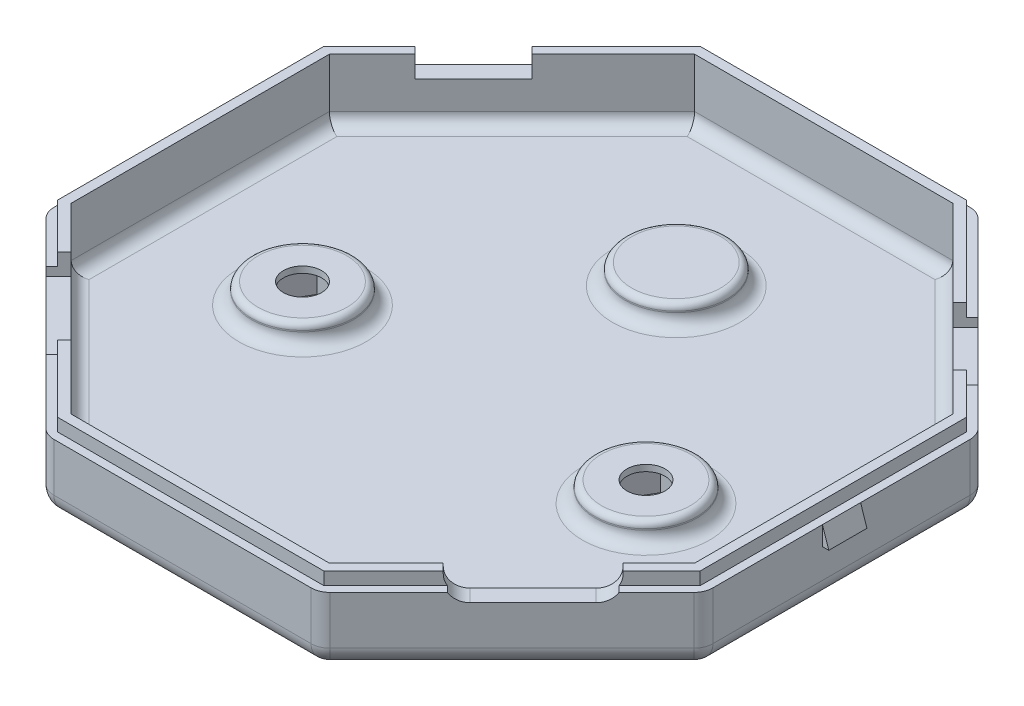
from build123d import *

# Parameters (mm, degrees)
BOSS_EXTRUDE1_DEPTH = 4.9
BOSS_EXTRUDE2_DEPTH = 1.4
SKETCH1_5_R         = 4
SKETCH1_5_R_2       = 1.5
BOSS_EXTRUDE3_DEPTH = 1.6
FILLET1_R           = 1
FILLET2_R           = 0.5
CUT_EXTRUDE1_DEPTH  = 1.7
FILLET3_R           = 1.5
CUT_EXTRUDE2_DEPTH  = 1
CUT_EXTRUDE4_DEPTH  = 10
CUT_EXTRUDE5_DEPTH  = 1.1
BOSS_EXTRUDE5_DEPTH = 1.5


with BuildPart() as part:
    # Sketch1 → Boss-Extrude1 (new body)
    with BuildSketch(Plane(origin=(0, 0, 0), x_dir=(1, 0, 0), z_dir=(0, 1, 0))):
        Polygon((25.9, -10.728131265), (25.9, 10.728131265), (10.728131265, 25.9), (-10.728131265, 25.9), (-25.9, 10.728131265), (-25.9, -10.728131265), (-10.728131265, -25.9), (10.728131265, -25.9), align=None)
        Polygon((10.148232278, 24.5), (24.5, 10.148232278), (24.5, -10.148232278), (10.148232278, -24.5), (-10.148232278, -24.5), (-24.5, -10.148232278), (-24.5, 10.148232278), (-10.148232278, 24.5), align=None, mode=Mode.SUBTRACT)
    extrude(amount=BOSS_EXTRUDE1_DEPTH)

    # Sketch1<4> → Boss-Extrude2 (add)
    with BuildSketch(Plane(origin=(0, 0, 0), x_dir=(1, 0, 0), z_dir=(0, 1, 0))):
        Polygon((25.9, -10.728131265), (25.9, 10.728131265), (10.728131265, 25.9), (-10.728131265, 25.9), (-25.9, 10.728131265), (-25.9, -10.728131265), (-10.728131265, -25.9), (10.728131265, -25.9), align=None)
    extrude(amount=-BOSS_EXTRUDE2_DEPTH)

    # Sketch1<5> → Boss-Extrude3 (add)
    # profile 1 of 3: a face of its own
    with BuildSketch(Plane(origin=(0, 0, 0), x_dir=(1, 0, 0), z_dir=(0, 1, 0))):
        with Locations((13.622546853, -3.09)):
            Circle(SKETCH1_5_R)
        with Locations((13.622546853, -3.09)):
            Circle(SKETCH1_5_R_2, mode=Mode.SUBTRACT)
    # profile 2 of 3: a face of its own
    with BuildSketch(Plane(origin=(0, 0, 0), x_dir=(1, 0, 0), z_dir=(0, 1, 0))):
        with Locations((-13.377453147, -3.09)):
            Circle(SKETCH1_5_R)
        with Locations((-13.377453147, -3.09)):
            Circle(SKETCH1_5_R_2, mode=Mode.SUBTRACT)
    # profile 3 of 3: a face of its own
    with BuildSketch(Plane(origin=(0, 0, 0), x_dir=(1, 0, 0), z_dir=(0, 1, 0))):
        with Locations((0, 12.91)):
            Circle(SKETCH1_5_R)
    extrude(amount=BOSS_EXTRUDE3_DEPTH)

    # Fillet1
    fillet1_edges = [part.edges().sort_by_distance(p)[0] for p in [
        (-17.377453147, 0, 3.09),
        (9.622546853, 0, 3.09),
        (24.5, 0, 0),
        (17.324116139, 0, 17.324116139),
        (0, 0, 24.5),
        (-17.324116139, 0, 17.324116139),
        (-24.5, 0, 0),
        (-17.324116139, 0, -17.324116139),
        (0, 0, -24.5),
        (17.324116139, 0, -17.324116139),
        (-4, 0, -12.91),
    ]]
    fillet(fillet1_edges, radius=FILLET1_R)

    # Fillet2
    fillet2_edges = [part.edges().sort_by_distance(p)[0] for p in [
        (9.622546853, 1.6, 3.09),
        (-17.377453147, 1.6, 3.09),
        (-4, 1.6, -12.91),
    ]]
    fillet(fillet2_edges, radius=FILLET2_R)

    # Sketch2 → Cut-Extrude1 (cut)
    with BuildSketch(Plane(origin=(0, 4.9, 0), x_dir=(1, 0, 0), z_dir=(0, 1, 0))):
        Polygon((-22.116978721, 14.511152545), (-21.127029227, 13.521203051), (-16.530835149, 18.117397129), (-17.520784643, 19.107346623), align=None)
        Polygon((16.919743879, 17.728488399), (17.909693373, 18.718437893), (22.50588745, 14.122243815), (21.515937957, 13.132294321), align=None)
        Polygon((21.692714652, -12.955517626), (22.682664146, -13.94546712), (15.611596334, -21.016534932), (14.62164684, -20.026585438), align=None)
        Polygon((-21.197739905, -13.450492373), (-22.187689399, -14.440441867), (-16.177281759, -20.450849507), (-15.187332265, -19.460900013), align=None)
    extrude(amount=-CUT_EXTRUDE1_DEPTH, mode=Mode.SUBTRACT)

    # Fillet3
    fillet3_edges = [part.edges().sort_by_distance(p)[0] for p in [
        (15.116621587, 3.2, 20.521560185),
        (22.187689399, 3.2, 13.450492373),
        (18.314065633, -1.4, -18.314065633),
        (0, -1.4, -25.9),
        (-18.314065633, -1.4, -18.314065633),
        (-25.9, -1.4, 0),
        (-18.314065633, -1.4, 18.314065633),
        (25.9, -1.4, 0),
        (18.314065633, -1.4, 18.314065633),
        (0, -1.4, 25.9),
        (-25.9, 1.75, -10.728131265),
        (-10.728131265, 1.75, -25.9),
        (10.728131265, 1.75, -25.9),
        (25.9, 1.75, -10.728131265),
        (25.9, 1.75, 10.728131265),
        (-25.9, 1.75, 10.728131265),
        (-10.728131265, 1.75, 25.9),
        (10.728131265, 1.75, 25.9),
    ]]
    fillet(fillet3_edges, radius=FILLET3_R)

    # Sketch3 → Cut-Extrude2 (cut)
    with BuildSketch(Plane(origin=(0, 4.9, 0), x_dir=(1, 0, 0), z_dir=(0, 1, 0))):
        with BuildLine():
            Line((11.167471094, -25.460660172), (25.460660172, -11.167471094))
            ThreePointArc((25.460660172, -11.167471094), (25.785819299, -10.68083607), (25.9, -10.106810922))
            Line((25.9, -10.106810922), (25.9, 10.106810922))
            ThreePointArc((25.9, 10.106810922), (25.785819299, 10.68083607), (25.460660172, 11.167471094))
            Line((25.460660172, 11.167471094), (22.50588745, 14.122243815))
            Line((22.50588745, 14.122243815), (22.046268043, 13.662624407))
            Line((22.046268043, 13.662624407), (25.25, 10.45889245))
            Line((25.25, 10.45889245), (25.25, -10.45889245))
            Line((25.25, -10.45889245), (10.45889245, -25.25))
            Line((10.45889245, -25.25), (-10.45889245, -25.25))
            Line((-10.45889245, -25.25), (-15.717662351, -19.991230099))
            Line((-15.717662351, -19.991230099), (-16.177281759, -20.450849507))
            Line((-16.177281759, -20.450849507), (-11.167471094, -25.460660172))
            ThreePointArc((-11.167471094, -25.460660172), (-10.68083607, -25.785819299), (-10.106810922, -25.9))
            Line((-10.106810922, -25.9), (10.106810922, -25.9))
            ThreePointArc((10.106810922, -25.9), (10.68083607, -25.785819299), (11.167471094, -25.460660172))
        make_face()
        with BuildLine():
            Line((-22.187689399, -14.440441867), (-21.728069991, -13.980822459))
            Line((-21.728069991, -13.980822459), (-25.25, -10.45889245))
            Line((-25.25, -10.45889245), (-25.25, 10.45889245))
            Line((-25.25, 10.45889245), (-21.657359313, 14.051533137))
            Line((-21.657359313, 14.051533137), (-22.116978721, 14.511152545))
            Line((-22.116978721, 14.511152545), (-25.460660172, 11.167471094))
            ThreePointArc((-25.460660172, 11.167471094), (-25.785819299, 10.68083607), (-25.9, 10.106810922))
            Line((-25.9, 10.106810922), (-25.9, -10.106810922))
            ThreePointArc((-25.9, -10.106810922), (-25.785819299, -10.68083607), (-25.460660172, -11.167471094))
            Line((-25.460660172, -11.167471094), (-22.187689399, -14.440441867))
        make_face()
        with BuildLine():
            Line((10.45889245, 25.25), (17.450073965, 18.258818485))
            Line((17.450073965, 18.258818485), (17.909693373, 18.718437893))
            Line((17.909693373, 18.718437893), (11.167471094, 25.460660172))
            ThreePointArc((11.167471094, 25.460660172), (10.68083607, 25.785819299), (10.106810922, 25.9))
            Line((10.106810922, 25.9), (-10.106810922, 25.9))
            ThreePointArc((-10.106810922, 25.9), (-10.68083607, 25.785819299), (-11.167471094, 25.460660172))
            Line((-11.167471094, 25.460660172), (-17.520784643, 19.107346623))
            Line((-17.520784643, 19.107346623), (-17.061165235, 18.647727215))
            Line((-17.061165235, 18.647727215), (-10.45889245, 25.25))
            Line((-10.45889245, 25.25), (10.45889245, 25.25))
        make_face()
    extrude(amount=-CUT_EXTRUDE2_DEPTH, mode=Mode.SUBTRACT)

    # Sketch4 → Cut-Extrude4 (cut)
    with BuildSketch(Plane(origin=(0, 0, 0), x_dir=(1, 0, 0), z_dir=(0, 1, 0))):
        Polygon((-11.81860742, -5.79), (-10.259761693, -3.09), (-11.81860742, -0.39), (-14.936298874, -0.39), (-16.4951446, -3.09), (-14.936298874, -5.79), align=None)
        Polygon((12.063701126, -0.39), (10.5048554, -3.09), (12.063701126, -5.79), (15.18139258, -5.79), (16.740238307, -3.09), (15.18139258, -0.39), align=None)
    extrude(amount=-CUT_EXTRUDE4_DEPTH, mode=Mode.SUBTRACT)

    # Sketch5 → Cut-Extrude5 (cut)
    with BuildSketch(Plane.XZ):
        Polygon((-11.81860742, 5.79), (-14.936298874, 5.79), (-16.4951446, 3.09), (-14.936298874, 0.39), (-11.81860742, 0.39), (-10.259761693, 3.09), align=None)
        Polygon((12.063701126, 0.39), (15.18139258, 0.39), (16.740238307, 3.09), (15.18139258, 5.79), (12.063701126, 5.79), (10.5048554, 3.09), align=None)
    extrude(amount=-CUT_EXTRUDE5_DEPTH, mode=Mode.SUBTRACT)

    # Sketch7 → Boss-Extrude5 (add, symmetric)
    with BuildSketch(Plane.XY):
        Polygon((-25.9, 3.9), (-26.4, 2.4), (-25.9, 2.4), align=None)
        Polygon((25.9, 3.9), (26.4, 2.4), (25.9, 2.4), align=None)
    extrude(amount=BOSS_EXTRUDE5_DEPTH, both=True)


solid = part.part
